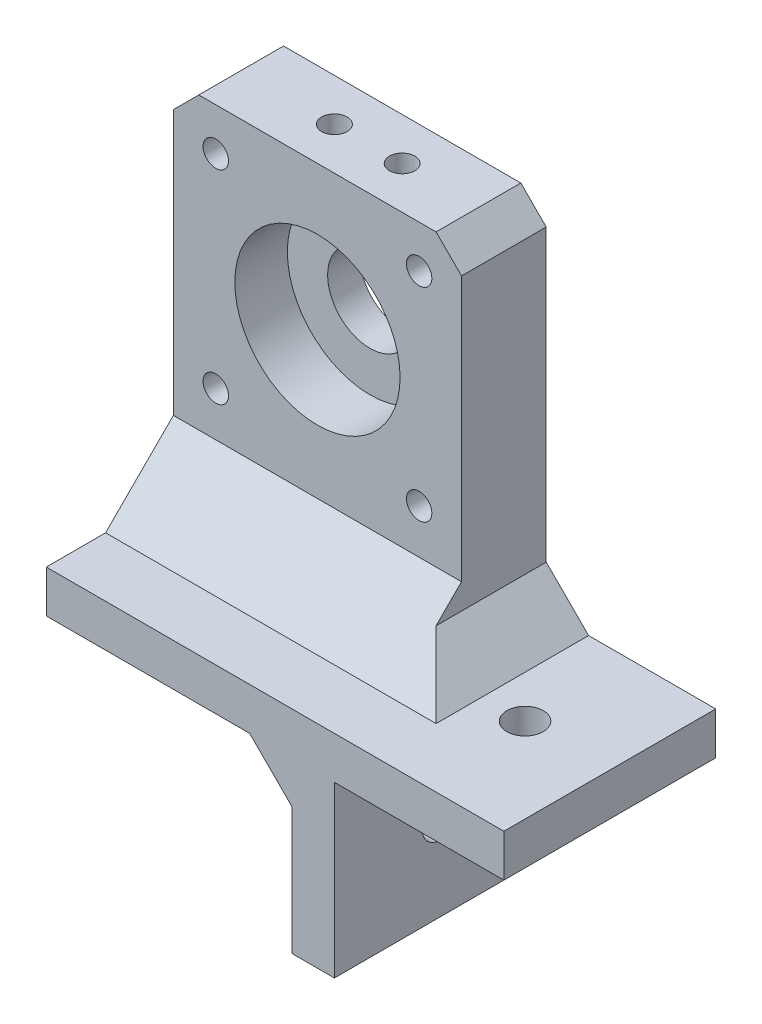
from build123d import *

# Parameters (mm, degrees)
SKETCH_1_R          = 5
SKETCH_1_R_2        = 1.5
EXTRUDE_1_DEPTH     = 25
SKETCH_2_R          = 2.15
CUT_EXTRUDE_1_DEPTH = 30
SKETCH_3_R          = 2.15
CUT_EXTRUDE_2_DEPTH = 30
SKETCH_4_W          = 34
SKETCH_4_H          = 42.25
CUT_EXTRUDE_3_DEPTH = 15
CHAMFER_1_SIZE      = 5
CHAMFER_2_SIZE      = 3
SKETCH_6_R          = 9.75
CUT_EXTRUDE_5_DEPTH = 6.2
EXTRUDE_2_DEPTH     = 5
SKETCH_8_W          = 91.561993536
SKETCH_8_H          = 85.949306993
CUT_EXTRUDE_6_DEPTH = 25
CHAMFER_3_SIZE      = 8
SKETCH_9_R          = 1.5
CUT_EXTRUDE_7_DEPTH = 10
SKETCH_10_R         = 1.5
CUT_EXTRUDE_8_DEPTH = 5


with BuildPart() as part:
    # 草图1 → 凸台-拉伸1 (new body)
    with BuildSketch(Plane.XY):
        Polygon((0, 0), (0, 20), (20, 20), (20, 25), (0, 25), (0, 67.25), (-34, 67.25), (-34, 20), (-5, 20), (-5, 0), align=None)
        with Locations((-17, 50.25)):
            Circle(SKETCH_1_R, mode=Mode.SUBTRACT)
        with Locations((-29, 62.25)):
            Circle(SKETCH_1_R_2, mode=Mode.SUBTRACT)
        with Locations((-5, 62.25)):
            Circle(SKETCH_1_R_2, mode=Mode.SUBTRACT)
        with Locations((-29, 38.25)):
            Circle(SKETCH_1_R_2, mode=Mode.SUBTRACT)
        with Locations((-5, 38.25)):
            Circle(SKETCH_1_R_2, mode=Mode.SUBTRACT)
    extrude(amount=EXTRUDE_1_DEPTH)

    # 草图2 → 切除-拉伸1 (cut)
    with BuildSketch(Plane(origin=(0, 0, 0), x_dir=(0, 0, -1), z_dir=(1, 0, 0))):
        with Locations((-12.5, 10)):
            Circle(SKETCH_2_R)
    extrude(amount=-CUT_EXTRUDE_1_DEPTH, mode=Mode.SUBTRACT)

    # 草图3 → 切除-拉伸2 (cut)
    with BuildSketch(Plane.XZ.offset(-20)):
        with Locations(Location((10, 12.5, 0), (0, 0, 270))):
            Circle(SKETCH_3_R)
    extrude(amount=-CUT_EXTRUDE_2_DEPTH, mode=Mode.SUBTRACT)

    # 草图4 → 切除-拉伸3 (cut)
    with BuildSketch(Plane(origin=(0, 0, 0), x_dir=(-1, 0, 0), z_dir=(0, 0, -1))):
        with Locations((17, 46.125)):
            Rectangle(SKETCH_4_W, SKETCH_4_H)
    extrude(amount=-CUT_EXTRUDE_3_DEPTH, mode=Mode.SUBTRACT)

    # 倒角1
    chamfer_1_edges = [part.edges().sort_by_distance(p)[0] for p in [
        (-5, 20, 12.5),
        (0, 25, 20),
    ]]
    chamfer(chamfer_1_edges, length=CHAMFER_1_SIZE)

    # 倒角2
    chamfer_2_edges = [part.edges().sort_by_distance(p)[0] for p in [
        (-34, 67.25, 20),
        (0, 67.25, 20),
    ]]
    chamfer(chamfer_2_edges, length=CHAMFER_2_SIZE)

    # 草图6 → 切除-拉伸5 (cut)
    with BuildSketch(Plane(origin=(0, 0, 15), x_dir=(-1, 0, 0), z_dir=(0, 0, -1))):
        with Locations((17, 50.25)):
            Circle(SKETCH_6_R)
    extrude(amount=-CUT_EXTRUDE_5_DEPTH, mode=Mode.SUBTRACT)

    # 草图7 → 凸台-拉伸2 (add)
    with BuildSketch(Plane.XY.offset(25)):
        Polygon((-34, 20), (-10, 20), (-5, 15), (-5, 0), align=None)
    extrude(amount=-EXTRUDE_2_DEPTH)


with BuildPart() as body_2:
    # 镜向1: mirrored copy
    add(part.part.mirror(Plane.XY.offset(25)))

    # 倒角3
    # the kernel refuses this chamfer: 8 mm, written as the material it adds along each edge
    with BuildSketch(Plane(origin=(-34, 25, 35), x_dir=(0, 0.9996219169112968, -0.027495876610586487), z_dir=(1, 0, 0))) as chamfer_3_piece_1_section:
        Polygon((CHAMFER_3_SIZE * 0.999621916911, CHAMFER_3_SIZE * 0.0274958766106), (-CHAMFER_3_SIZE * 0.0274958766106, CHAMFER_3_SIZE * 0.999621916911), (0, 0), align=None)
    chamfer_3_piece_1 = extrude(amount=59.573463904, mode=Mode.PRIVATE)
    chamfer_3_piece_1 = split(chamfer_3_piece_1, bisect_by=Plane(origin=(0, 27.617876763, 37.64907513), z_dir=(-1, 0, 0)), keep=Keep.TOP, mode=Mode.PRIVATE)
    chamfer_3_piece_1 = split(chamfer_3_piece_1, bisect_by=Plane(origin=(-7.349818702, 37.349818702, 37.64907513), z_dir=(-0.7071067811865476, -0.7071067811865476, 0)), keep=Keep.TOP, mode=Mode.PRIVATE)
    add(chamfer_3_piece_1)
    with BuildSketch(Plane(origin=(-34, 25, 35), x_dir=(0, 0.9996219169112968, -0.027495876610586487), z_dir=(1, 0, 0))) as chamfer_3_piece_2_section:
        Polygon((CHAMFER_3_SIZE * 0.999621916911, CHAMFER_3_SIZE * 0.0274958766106), (-CHAMFER_3_SIZE * 0.0274958766106, CHAMFER_3_SIZE * 0.999621916911), (0, 0), align=None)
    chamfer_3_piece_2 = extrude(amount=59.573463904, mode=Mode.PRIVATE)
    chamfer_3_piece_2 = split(chamfer_3_piece_2, bisect_by=Plane(origin=(0, 26.307184644, 38.352912701), z_dir=(1, 0, 0)), keep=Keep.TOP, mode=Mode.PRIVATE)
    chamfer_3_piece_2 = split(chamfer_3_piece_2, bisect_by=Plane(origin=(2.769611517, 27.230388483, 38.352912701), z_dir=(-0.7071067811865476, -0.7071067811865476, 0)), keep=Keep.TOP, mode=Mode.PRIVATE)
    add(chamfer_3_piece_2)
    with BuildSketch(Plane(origin=(-34, 25, 35), x_dir=(0, 0.9996219169112968, -0.027495876610586487), z_dir=(1, 0, 0))) as chamfer_3_piece_3_section:
        Polygon((CHAMFER_3_SIZE * 0.999621916911, CHAMFER_3_SIZE * 0.0274958766106), (-CHAMFER_3_SIZE * 0.0274958766106, CHAMFER_3_SIZE * 0.999621916911), (0, 0), align=None)
    chamfer_3_piece_3 = extrude(amount=59.573463904, mode=Mode.PRIVATE)
    chamfer_3_piece_3 = split(chamfer_3_piece_3, bisect_by=Plane(origin=(0, 31.684169789, 35.518604569), z_dir=(-1, 0, 0)), keep=Keep.TOP, mode=Mode.PRIVATE)
    chamfer_3_piece_3 = split(chamfer_3_piece_3, bisect_by=Plane(origin=(-1.263127342, 31.263127342, 35.518604569), z_dir=(0.7071067811865476, 0.7071067811865476, 0)), keep=Keep.TOP, mode=Mode.PRIVATE)
    add(chamfer_3_piece_3)

    # 草图9 → 切除-拉伸7 (cut)
    with BuildSketch(Plane.ZY.offset(34)):
        with Locations(Location((40, 24, 0), (0, 0, 270))):
            Circle(SKETCH_9_R)
        with Locations(Location((32, 24, 0), (0, 0, 270))):
            Circle(SKETCH_9_R)
    extrude(amount=-CUT_EXTRUDE_7_DEPTH, mode=Mode.SUBTRACT)

    # 草图10 → 切除-拉伸8 (cut)
    with BuildSketch(Plane(origin=(0, 67.25, 0), x_dir=(1, 0, 0), z_dir=(0, 1, 0))):
        with Locations(Location((-12, -30, 0), (0, 0, 270))):
            Circle(SKETCH_10_R)
        with Locations(Location((-20, -30, 0), (0, 0, 270))):
            Circle(SKETCH_10_R)
    extrude(amount=-CUT_EXTRUDE_8_DEPTH, mode=Mode.SUBTRACT)


with BuildPart() as part_1:
    add(part.part)

    # 草图8 → 切除-拉伸6 (cut)
    with BuildSketch(Plane(origin=(0, 0, 0), x_dir=(-1, 0, 0), z_dir=(0, 0, -1))):
        with Locations((16.502686865, 35.124779943)):
            Rectangle(SKETCH_8_W, SKETCH_8_H)
    extrude(amount=-CUT_EXTRUDE_6_DEPTH, mode=Mode.SUBTRACT)


solid = body_2.part
